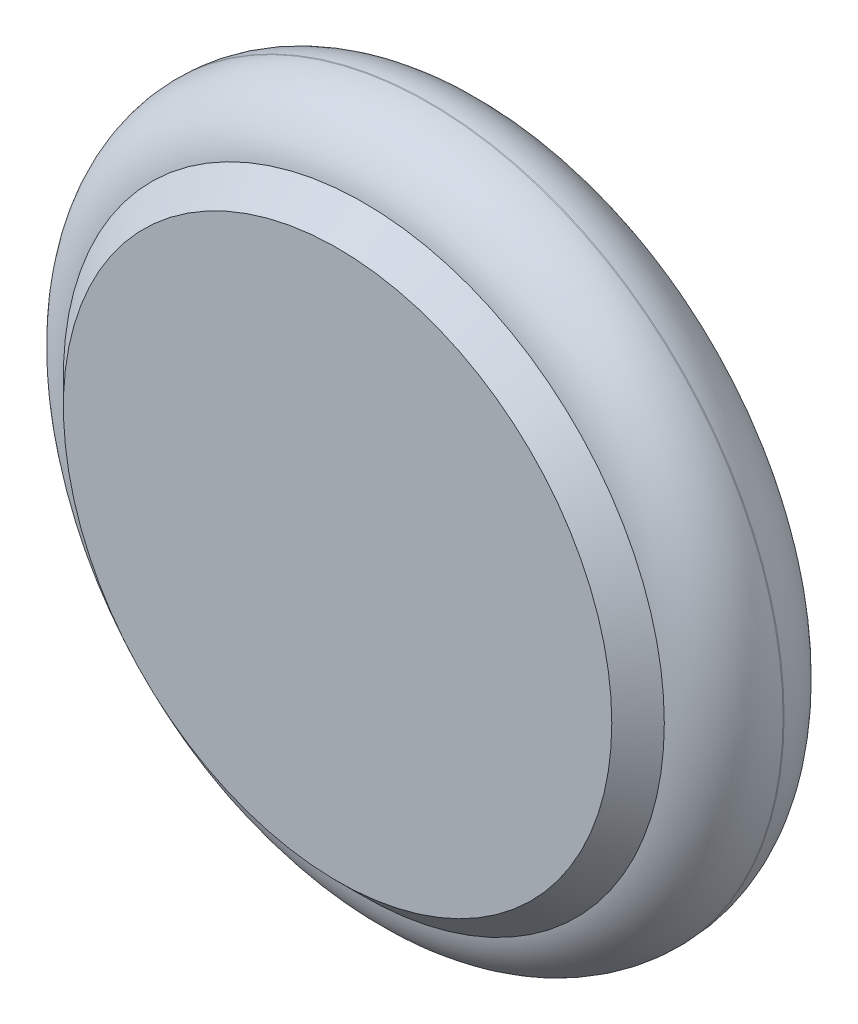
from build123d import *

# Parameters (mm, degrees)
SKETCH1_R           = 108
BOSS_EXTRUDE1_DEPTH = 40
SKETCH3_R           = 91.518206512
BOSS_EXTRUDE3_DEPTH = 8
CHAMFER1_SIZE       = 8
FILLET2_R           = 20
SKETCH5_R           = 20
BOSS_EXTRUDE4_DEPTH = 2
CHAMFER2_SIZE       = 4


# Some blends are built 0.0001 mm under size
with BuildPart() as part:
    # Sketch1 → Boss-Extrude1 (new body)
    with BuildSketch(Plane.XY):
        Circle(SKETCH1_R)
    extrude(amount=BOSS_EXTRUDE1_DEPTH)

    # Sketch3 → Boss-Extrude3 (add)
    with BuildSketch(Plane.XY.offset(40)):
        Circle(SKETCH3_R)
    extrude(amount=BOSS_EXTRUDE3_DEPTH)

    # Chamfer1
    chamfer1_edges = [part.edges().sort_by_distance(p)[0] for p in [
        (-91.518206512, 0, 48),
    ]]
    chamfer(chamfer1_edges, length=CHAMFER1_SIZE - 0.0001)  # a hair under: the kernel refuses the full size

    # Fillet2
    # the kernel refuses this fillet: 20 mm, written as the material it takes off along each edge
    with BuildSketch(Plane(origin=(0, 0, 0), x_dir=(1, 0, 0), z_dir=(0, -1, 0))) as fillet2_piece_1:
        with BuildLine():
            CenterArc((108 - FILLET2_R, FILLET2_R), FILLET2_R, 270, 90)
            Line((108 - FILLET2_R, 0), (108 - FILLET2_R, -FILLET2_R * 0.02))
            Line((108 - FILLET2_R, -FILLET2_R * 0.02), (108 + FILLET2_R * 0.02, -FILLET2_R * 0.02))
            Line((108 + FILLET2_R * 0.02, -FILLET2_R * 0.02), (108 + FILLET2_R * 0.02, FILLET2_R))
            Line((108 + FILLET2_R * 0.02, FILLET2_R), (108, FILLET2_R))
        make_face()
    revolve(axis=Axis((0, 0, 0), (0, 0, 1)), mode=Mode.SUBTRACT)
    with BuildSketch(Plane(origin=(0, 0, 40), x_dir=(1, 0, 0), z_dir=(0, -1, 0))) as fillet2_piece_2:
        with BuildLine():
            CenterArc((88, -19.688123906), FILLET2_R, 0, 79.868362225)
            Line((108, -19.688123906), (108.4, -19.688123906))
            Line((108.4, -19.688123906), (108.4, 0))
            Line((108.4, 0), (108, 0.4))
            ThreePointArc((108, 0.4), (99.759103256, 0.4), (91.588570642, 0.393762478))
            Line((91.588570642, 0.393762478), (91.518206512, 0))
        make_face()
    revolve(axis=Axis((0, 0, 40), (0, 0, 1)), mode=Mode.SUBTRACT)

    # Sketch5 → Boss-Extrude4 (add)
    with BuildSketch(Plane(origin=(0, 0, 0), x_dir=(-1, 0, 0), z_dir=(0, 0, -1))):
        with Locations(Location((0, 0, 0), (0, 0, 180))):
            Circle(SKETCH5_R)
    extrude(amount=BOSS_EXTRUDE4_DEPTH)

    # Chamfer2
    # the kernel refuses this chamfer: 4 mm, written as the material it takes off along each edge
    with BuildSketch(Plane(origin=(0, 0, -2), x_dir=(1, 0, 0), z_dir=(0, 1, 0))) as chamfer2_piece_1_section:
        Polygon((20, -CHAMFER2_SIZE), (20 - CHAMFER2_SIZE, 0), (20, 0), align=None)
    chamfer2_piece_1 = revolve(axis=Axis((0, 0, -2), (0, 0, -1)), mode=Mode.PRIVATE)
    chamfer2_piece_1 = split(chamfer2_piece_1, bisect_by=Plane(origin=(-17.007894049, 0, 0), z_dir=(0, 0, -1)), keep=Keep.TOP, mode=Mode.PRIVATE)
    add(chamfer2_piece_1, mode=Mode.SUBTRACT)


solid = part.part
